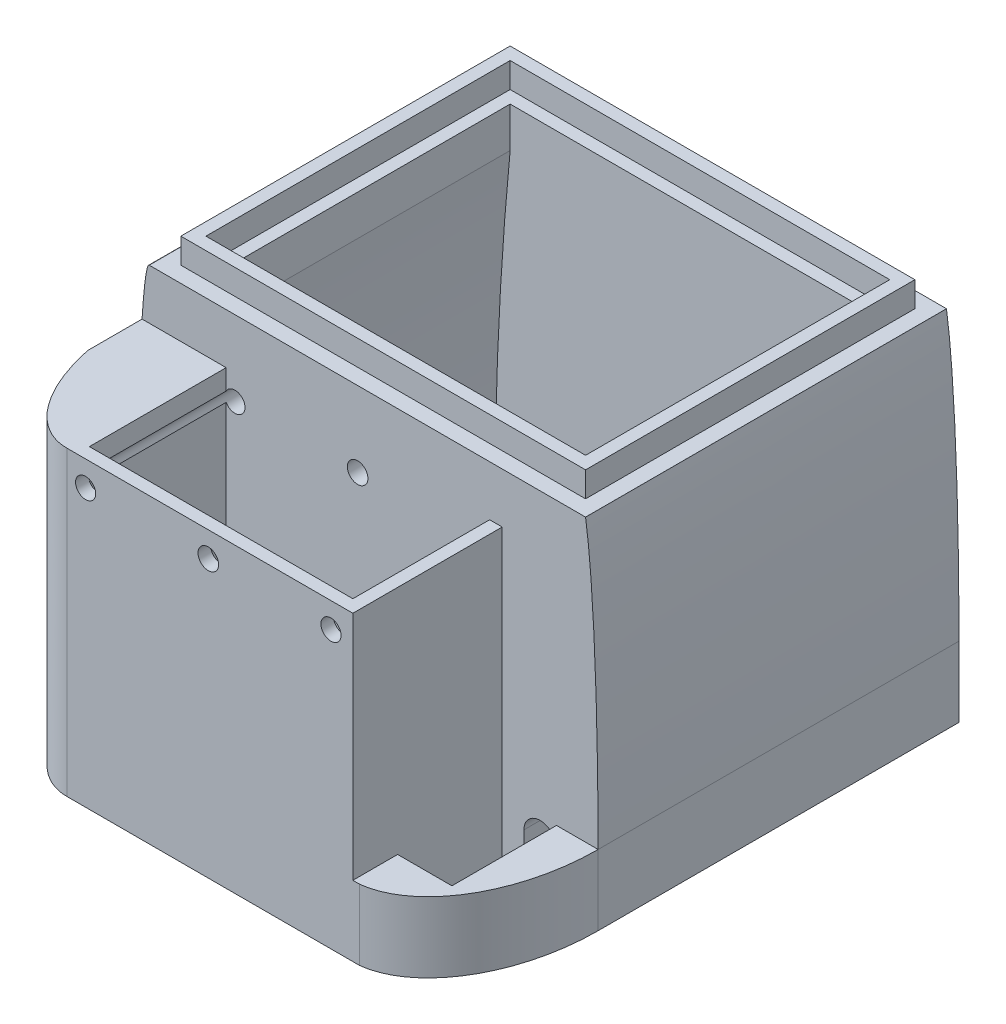
from build123d import *

# Parameters (mm, degrees)
SKETCH3_W            = 55.1053
SKETCH3_H            = 45.5803
BOSS_EXTRUDE2_DEPTH  = 44.45
SKETCH11_W           = 51.1175
SKETCH11_H           = 41.5925
SKETCH11_W_2         = 47.9425
SKETCH11_H_2         = 38.4175
BOSS_EXTRUDE3_DEPTH  = 3.175
SKETCH13_W           = 44.7675
SKETCH13_H           = 35.2425
CUT_EXTRUDE3_DEPTH   = 73.294764944
CUT_EXTRUDE4_DEPTH   = 5.1689
SKETCH19_W           = 1.5875
SKETCH19_H           = 45.5803
BOSS_EXTRUDE4_DEPTH  = 44.45
SKETCH21_W           = 1.905
SKETCH21_H           = 35.2425
CUT_EXTRUDE5_DEPTH   = 39.37
FILLET1_R            = 406.4
FILLET2_R            = 406.4
SKETCH22_R           = 1.524
CUT_EXTRUDE7_DEPTH   = 3.175
BOSS_EXTRUDE5_DEPTH  = 38.1
SKETCH39_R           = 1.296908885
SKETCH39_R_2         = 1.27
CUT_EXTRUDE14_DEPTH  = 25.4
BOSS_EXTRUDE22_DEPTH = 8.89
CUT_EXTRUDE15_DEPTH  = 88.778493945
SKETCH48_W           = 18.8595
SKETCH48_H           = 29.21
BOSS_EXTRUDE23_DEPTH = 1.5875
SKETCH52_R           = 1.27
CUT_EXTRUDE16_DEPTH  = 25.4


with BuildPart() as part:
    # Sketch3 → Boss-Extrude2 (new body)
    with BuildSketch(Plane(origin=(0, 0, 0), x_dir=(1, 0, 0), z_dir=(0, 1, 0))):
        with Locations((6.69887245, -22.79015)):
            Rectangle(SKETCH3_W, SKETCH3_H)
    extrude(amount=BOSS_EXTRUDE2_DEPTH)

    # Sketch11 → Boss-Extrude3 (add)
    with BuildSketch(Plane(origin=(0, 44.45, 0), x_dir=(1, 0, 0), z_dir=(0, 1, 0))):
        with Locations((6.69887245, -22.79015)):
            Rectangle(SKETCH11_W, SKETCH11_H)
        with Locations((6.69887245, -22.79015)):
            Rectangle(SKETCH11_W_2, SKETCH11_H_2, mode=Mode.SUBTRACT)
    extrude(amount=BOSS_EXTRUDE3_DEPTH)

    # Sketch13 → Cut-Extrude3 (cut, through all)
    with BuildSketch(Plane(origin=(0, 44.45, 0), x_dir=(1, 0, 0), z_dir=(0, 1, 0))):
        with Locations((6.69887245, -22.79015)):
            Rectangle(SKETCH13_W, SKETCH13_H)
    extrude(amount=-CUT_EXTRUDE3_DEPTH, mode=Mode.SUBTRACT)

    # Sketch14 → Cut-Extrude4 (cut)
    with BuildSketch(Plane.XY.offset(45.5803)):
        with BuildLine():
            Line((-2.82612755, 6.35), (-2.82612755, 0))
            Line((-2.82612755, 0), (3.52387245, 0))
            Line((3.52387245, 0), (3.52387245, 6.35))
            ThreePointArc((3.52387245, 6.35), (0.34887245, 9.525), (-2.82612755, 6.35))
        make_face()
        with BuildLine():
            Line((9.87387245, 6.35), (9.87387245, 0))
            Line((9.87387245, 0), (16.22387245, 0))
            Line((16.22387245, 0), (16.22387245, 6.35))
            ThreePointArc((16.22387245, 6.35), (13.04887245, 9.525), (9.87387245, 6.35))
        make_face()
        with BuildLine():
            Line((26.465313364, 0), (30.581222486, 0))
            Line((30.581222486, 0), (30.581222486, 6.35))
            ThreePointArc((30.581222486, 6.35), (28.523267925, 8.407954561), (26.465313364, 6.35))
            Line((26.465313364, 6.35), (26.465313364, 0))
        make_face()
    extrude(amount=-CUT_EXTRUDE4_DEPTH, mode=Mode.SUBTRACT)

    # Sketch19 → Boss-Extrude4 (add)
    with BuildSketch(Plane.XZ):
        with Locations((-21.64752755, 22.79015)):
            Rectangle(SKETCH19_W, SKETCH19_H)
        with Locations((35.04527245, 22.79015)):
            Rectangle(SKETCH19_W, SKETCH19_H)
    extrude(amount=-BOSS_EXTRUDE4_DEPTH)

    # Sketch21 → Cut-Extrude5 (cut)
    with BuildSketch(Plane(origin=(0, 0, 0), x_dir=(-1, 0, 0), z_dir=(0, -1, 0))):
        with Locations((16.63737755, -22.79015)):
            Rectangle(SKETCH21_W, SKETCH21_H)
        with Locations((-30.03512245, -22.79015)):
            Rectangle(SKETCH21_W, SKETCH21_H)
    extrude(amount=-CUT_EXTRUDE5_DEPTH, mode=Mode.SUBTRACT)

    # Fillet1
    # the kernel refuses this fillet: 406.4 mm, written as the material it adds along each edge
    with BuildSketch(Plane(origin=(-17.58987755, 39.37, 40.4114), x_dir=(0, -1, 0), z_dir=(0, 0, -1))) as fillet1_piece_1:
        with BuildLine():
            CenterArc((39.303371039, -406.4), FILLET1_R, 90, 5.549809332)
            Line((0, -1.905), (0, 0))
            Line((0, 0), (39.303371039, 0))
        make_face()
    extrude(amount=35.2425)

    # Fillet2
    # the kernel refuses this fillet: 406.4 mm, written as the material it adds along each edge
    with BuildSketch(Plane(origin=(30.98762245, 39.37, -93.089527597), x_dir=(-1, 0, 0), z_dir=(0, 0, 1))) as fillet2_piece_1_section:
        with BuildLine():
            CenterArc((406.4, 39.303371039), FILLET2_R, 180, 5.549809332)
            Line((0, 39.303371039), (0, 0))
            Line((0, 0), (1.905, 0))
        make_face()
    fillet2_piece_1 = extrude(amount=231.759355193, mode=Mode.PRIVATE)
    fillet2_piece_1 = split(fillet2_piece_1, bisect_by=Plane(origin=(30.98762245, 39.37, 45.5803), z_dir=(0, 0, -1)), keep=Keep.TOP, mode=Mode.PRIVATE)
    fillet2_piece_1 = split(fillet2_piece_1, bisect_by=Plane(origin=(30.98762245, 39.37, 0), z_dir=(0, 0, 1)), keep=Keep.TOP, mode=Mode.PRIVATE)
    add(fillet2_piece_1)

    # Sketch22 → Cut-Extrude7 (cut)
    with BuildSketch(Plane.XZ):
        with Locations(Location((-19.64727755, 42.7863, 0), (0, 0, 270))):
            Circle(SKETCH22_R)
        with Locations(Location((33.04502245, 42.7863, 0), (0, 0, 270))):
            Circle(SKETCH22_R)
        with Locations(Location((-19.64727755, 2.794, 0), (0, 0, 270))):
            Circle(SKETCH22_R)
        with Locations(Location((33.04502245, 2.794, 0), (0, 0, 270))):
            Circle(SKETCH22_R)
    extrude(amount=-CUT_EXTRUDE7_DEPTH, mode=Mode.SUBTRACT)

    # Sketch23 → Boss-Extrude5 (add)
    with BuildSketch(Plane.XZ):
        with BuildLine():
            Line((22.13572245, 62.8523), (22.13572245, 64.4398))
            Line((22.13572245, 64.4398), (21.379894456, 64.4398))
            Line((21.379894456, 64.4398), (-12.40827755, 64.4398))
            add(Edge.make_bspline(
                [(-12.40827755, 64.4398), (-22.44127755, 64.4398), (-22.44127755, 45.5803)],
                knots=[0, 0, 0, 1.570796327, 1.570796327, 1.570796327], degree=2, weights=[1, 0.707106781, 1]))
            Line((-22.44127755, 45.5803), (-11.13827755, 45.5803))
            Line((-11.13827755, 45.5803), (-11.13827755, 58.170091836))
            Line((-11.13827755, 58.170091836), (-11.13827755, 62.8523))
            Line((-11.13827755, 62.8523), (22.13572245, 62.8523))
        make_face()
    extrude(amount=-BOSS_EXTRUDE5_DEPTH)

    # Sketch39 → Cut-Extrude14 (cut)
    with BuildSketch(Plane.XY.offset(64.4398)):
        with Locations((5.46697245, 34.925)):
            Circle(SKETCH39_R)
        with Locations((-10.02702755, 34.925)):
            Circle(SKETCH39_R_2)
        with Locations((20.96097245, 34.925)):
            Circle(SKETCH39_R_2)
    extrude(amount=-CUT_EXTRUDE14_DEPTH, mode=Mode.SUBTRACT)

    # Sketch43 → Boss-Extrude22 (add)
    with BuildSketch(Plane.XZ):
        with BuildLine():
            Line((30.58122245, 45.5803), (35.83902245, 45.5803))
            add(Edge.make_bspline(
                [(35.83902245, 45.5803), (35.83902245, 63.254133988), (24.53602245, 64.4398)],
                knots=[4.71238898, 4.71238898, 4.71238898, 6.216048931, 6.216048931, 6.216048931], degree=2, weights=[1, 0.730440262, 1]))
            Line((24.53602245, 64.4398), (22.13572245, 64.4398))
            Line((22.13572245, 64.4398), (22.13572245, 45.5803))
            Line((22.13572245, 45.5803), (23.72322245, 45.5803))
            Line((23.72322245, 45.5803), (23.72322245, 58.7883))
            Line((23.72322245, 58.7883), (30.58122245, 58.7883))
            Line((30.58122245, 58.7883), (30.58122245, 45.5803))
        make_face()
    extrude(amount=-BOSS_EXTRUDE22_DEPTH)

    # Sketch51 → Cut-Extrude15 (cut, through all)
    with BuildSketch(Plane.XY.offset(64.4398)):
        with BuildLine():
            add(Edge.make_bspline(
                [(-20.85377755, 44.45), (-22.44127755, 44.45), (-22.44127755, 8.89)],
                knots=[3.141592654, 3.141592654, 3.141592654, 4.71238898, 4.71238898, 4.71238898], degree=2, weights=[1, 0.707106781, 1]))
            Line((-22.44127755, 8.89), (-23.728758276, 8.89))
            Line((-23.728758276, 8.89), (-23.728758276, 45.620970636))
            Line((-23.728758276, 45.620970636), (-20.85377755, 45.620970636))
            Line((-20.85377755, 45.620970636), (-20.85377755, 44.45))
        make_face()
        with BuildLine():
            add(Edge.make_bspline(
                [(35.83902245, 8.89), (35.83902245, 34.352534387), (34.251533964, 44.439253731)],
                knots=[4.71238898, 4.71238898, 4.71238898, 5.875876601, 5.875876601, 5.875876601], degree=2, weights=[1, 0.835505729, 1]))
            Line((34.251533964, 44.439253731), (34.25152245, 44.45))
            Line((34.25152245, 44.45), (34.25152245, 45.620970636))
            Line((34.25152245, 45.620970636), (37.555875031, 45.620970636))
            Line((37.555875031, 45.620970636), (37.555875031, 8.89))
            Line((37.555875031, 8.89), (35.83902245, 8.89))
        make_face()
    extrude(amount=-CUT_EXTRUDE15_DEPTH, mode=Mode.SUBTRACT)

    # Sketch48 → Boss-Extrude23 (add)
    with BuildSketch(Plane(origin=(22.13572245, 0, 0), x_dir=(0, 0, -1), z_dir=(1, 0, 0))):
        with Locations((-55.01005, 23.495)):
            Rectangle(SKETCH48_W, SKETCH48_H)
    extrude(amount=BOSS_EXTRUDE23_DEPTH)

    # Sketch52 → Cut-Extrude16 (cut)
    with BuildSketch(Plane.XY.offset(64.4398)):
        with Locations((20.96097245, 34.925)):
            Circle(SKETCH52_R)
    extrude(amount=-CUT_EXTRUDE16_DEPTH, mode=Mode.SUBTRACT)


solid = part.part
